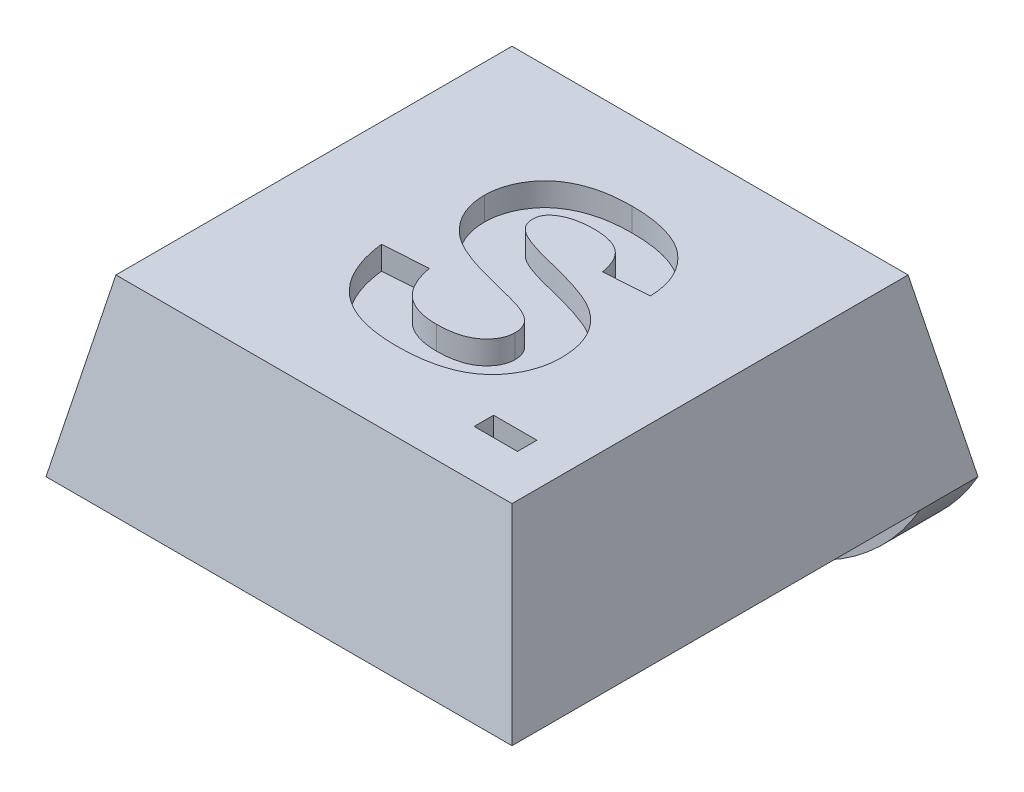
from build123d import *

# Parameters (mm, degrees)
SKETCH1_W               = 8
SKETCH1_H               = 8
BOSS_EXTRUDE1_DEPTH     = 3
CUT_EXTRUDE1_DEPTH      = 12.704699911
CUT_EXTRUDE1_DEPTH_BACK = 12.704699911
CUT_EXTRUDE2_DEPTH      = 11
SKETCH4_R               = 1.75
CUT_EXTRUDE3_DEPTH      = 0.4
SKETCH5_W               = 8
SKETCH5_H               = 1
BOSS_EXTRUDE2_DEPTH     = 2
FILLET1_R               = 4
CUT_EXTRUDE4_DEPTH      = 0.4
SKETCH7_W               = 0.743589743
SKETCH7_H               = 0.333333333
CUT_EXTRUDE5_DEPTH      = 0.5


with BuildPart() as part:
    # Sketch1 → Boss-Extrude1 (new body)
    with BuildSketch(Plane(origin=(0, 0, 0), x_dir=(1, 0, 0), z_dir=(0, 1, 0))):
        with Locations((4, 4)):
            Rectangle(SKETCH1_W, SKETCH1_H)
    extrude(amount=BOSS_EXTRUDE1_DEPTH)

    # Sketch2 → Cut-Extrude1 (cut, two sides: drawn at the far end of the back side and taken through both)
    with BuildSketch(Plane.XY.offset(-CUT_EXTRUDE1_DEPTH_BACK)):
        Polygon((0, 0), (0.6, 3), (0, 3), align=None)
        Polygon((8, 0), (7.4, 3), (8, 3), align=None)
    extrude(amount=CUT_EXTRUDE1_DEPTH + CUT_EXTRUDE1_DEPTH_BACK, mode=Mode.SUBTRACT)

    # Sketch3 → Cut-Extrude2 (cut)
    with BuildSketch(Plane(origin=(0, 0, 0), x_dir=(0, 0, -1), z_dir=(1, 0, 0))):
        Polygon((0, 0), (0.6, 3), (0, 3), align=None)
        Polygon((8, 3), (7.4, 3), (8, 0), align=None)
    extrude(amount=CUT_EXTRUDE2_DEPTH, mode=Mode.SUBTRACT)

    # Sketch4 → Cut-Extrude3 (cut)
    with BuildSketch(Plane.XZ):
        with Locations(Location((4, -3.75, 0), (0, 0, 270))):
            Circle(SKETCH4_R)
    extrude(amount=-CUT_EXTRUDE3_DEPTH, mode=Mode.SUBTRACT)

    # Sketch5 → Boss-Extrude2 (add)
    with BuildSketch(Plane.XZ):
        with Locations((4, -7.5)):
            Rectangle(SKETCH5_W, SKETCH5_H)
    extrude(amount=BOSS_EXTRUDE2_DEPTH)

    # Fillet1
    # the kernel refuses this fillet: 4 mm, written as the material it takes off along each edge
    with BuildSketch(Plane(origin=(8, -2, -16.660254038), x_dir=(0, 1, 0), z_dir=(0, 0, 1)), Plane(origin=(0, -2, 1.660254038), x_dir=(0, 1, 0), z_dir=(0, 0, -1))) as fillet1_piece_1:
        with BuildLine():
            CenterArc((4, 3.464101615), FILLET1_R, 180, 60)
            Line((0, 3.464101615), (-0.08, 3.464101615))
            Line((-0.08, 3.464101615), (-0.08, 0))
            Line((-0.08, 0), (0, -0.08))
            ThreePointArc((0, -0.08), (1, -0.08), (1.96, -0.069282032))
            Line((1.96, -0.069282032), (2, 0))
        make_face()
    extrude(amount=18.320508076, mode=Mode.SUBTRACT)

    # Sketch6 → Cut-Extrude4 (cut)
    with BuildSketch(Plane(origin=(0, 3, 0), x_dir=(1, 0, 0), z_dir=(0, 1, 0))):
        with BuildLine():
            Line((2.423916505, 3.336189685), (3.193147274, 3.387471736))
            add(Edge.make_bspline(
                [(3.193147274, 3.387471736), (3.199275518, 3.35528983), (3.211179242, 3.292778523), (3.237627081, 3.203691377), (3.266738832, 3.12063689), (3.30152897, 3.044505684), (3.339615284, 2.973890515), (3.38412658, 2.910803039), (3.431957638, 2.853229033), (3.485476185, 2.803236311), (3.543783948, 2.759451994), (3.607171876, 2.722111271), (3.674953108, 2.6897922), (3.747293374, 2.663178469), (3.824938253, 2.64331119), (3.907211345, 2.629176798), (3.994230643, 2.620125524), (4.053701404, 2.618879435), (4.084172915, 2.618240967)],
                knots=[0, 0, 0, 0, 1.204560339, 2.339781841, 3.415289417, 4.440034832, 5.416475564, 6.362424008, 7.275913008, 8.16578645, 9.05021719, 9.95355393, 10.867835453, 11.809845306, 12.784702352, 13.812224031, 14.87903166, 16, 16, 16, 16], degree=3))
            add(Edge.make_bspline(
                [(4.084172915, 2.618240967), (4.116246108, 2.618590883), (4.178630121, 2.619271489), (4.269031453, 2.627715), (4.353560804, 2.639811238), (4.431471751, 2.6589593), (4.504219207, 2.680373377), (4.569996427, 2.709670116), (4.629867843, 2.743459668), (4.683679212, 2.781802056), (4.730640445, 2.824326515), (4.771724475, 2.86872067), (4.807505951, 2.914025405), (4.835668504, 2.962251146), (4.858460082, 3.011447443), (4.873523718, 3.063081907), (4.883700097, 3.1159689), (4.884867031, 3.152113555), (4.885454967, 3.1703243)],
                knots=[0, 0, 0, 0, 1.417779877, 2.757654889, 4.012140507, 5.189587551, 6.302846416, 7.360586765, 8.365575446, 9.33904572, 10.275781718, 11.161696098, 12.012180333, 12.822428111, 13.625933072, 14.403138519, 15.195454004, 16, 16, 16, 16], degree=3))
            add(Edge.make_bspline(
                [(4.885454967, 3.1703243), (4.884733913, 3.193140887), (4.883323278, 3.237778199), (4.866340641, 3.301592127), (4.840872442, 3.360713887), (4.802526135, 3.41427025), (4.750979261, 3.463212961), (4.685226085, 3.508997669), (4.603431212, 3.550186), (4.542750055, 3.573160928), (4.510454967, 3.585388403)],
                knots=[0, 0, 0, 0, 0.90494901, 1.770400303, 2.607161909, 3.452839393, 4.36912122, 5.420987164, 6.627424851, 8, 8, 8, 8], degree=3))
            add(Edge.make_bspline(
                [(4.510454967, 3.585388403), (4.496597999, 3.590031937), (4.465588357, 3.600423411), (4.4126892, 3.615282239), (4.348970759, 3.633836968), (4.273512264, 3.654927379), (4.186339087, 3.676497317), (4.088424838, 3.703069034), (3.978575834, 3.729510064), (3.901725338, 3.749028827), (3.861416505, 3.759266608)],
                knots=[0, 0, 0, 0, 0.521821638, 1.167752076, 1.961721917, 2.891982557, 3.96540661, 5.168436773, 6.514817513, 8, 8, 8, 8], degree=3))
            add(Edge.make_bspline(
                [(3.861416505, 3.759266608), (3.808922441, 3.772373151), (3.707643728, 3.797660082), (3.563197092, 3.84264374), (3.430159098, 3.887337495), (3.309810688, 3.935832618), (3.200824367, 3.984842463), (3.104963023, 4.037807847), (3.02022624, 4.091978089), (2.970848149, 4.132466251), (2.947153685, 4.151894813)],
                knots=[0, 0, 0, 0, 1.293880989, 2.496331788, 3.617634808, 4.64976062, 5.598842568, 6.473791081, 7.267636666, 8, 8, 8, 8], degree=3))
            add(Edge.make_bspline(
                [(2.947153685, 4.151894813), (2.917769469, 4.179407128), (2.860158996, 4.233347566), (2.784323751, 4.321982057), (2.720601495, 4.415610216), (2.668151102, 4.513540942), (2.627765291, 4.616338017), (2.599140348, 4.723313361), (2.580613245, 4.834746169), (2.578722682, 4.91063455), (2.577762659, 4.949170454)],
                knots=[0, 0, 0, 0, 1.064429417, 2.086912298, 3.078678339, 4.055528992, 5.020032834, 5.993708893, 6.981211098, 8, 8, 8, 8], degree=3))
            add(Edge.make_bspline(
                [(2.577762659, 4.949170454), (2.579632311, 4.999035454), (2.583341142, 5.097952729), (2.617353538, 5.24334762), (2.670335558, 5.383642492), (2.731782138, 5.495041815), (2.790819043, 5.579315825), (2.839844896, 5.639790083), (2.893704531, 5.696388175), (2.953135712, 5.747729494), (3.015931612, 5.796821395), (3.084525186, 5.840415592), (3.156971597, 5.881478913), (3.261809808, 5.93015757), (3.404151332, 5.980885512), (3.589345301, 6.023645948), (3.790984862, 6.049350493), (3.930782191, 6.052503897), (4.003243428, 6.054138403)],
                knots=[0, 0, 0, 0, 1.180131776, 2.341029169, 3.518901375, 4.725685298, 5.343762192, 5.955650671, 6.568945152, 7.192346361, 7.815201106, 8.455999361, 9.116257477, 9.787318263, 11.192748436, 12.688084276, 14.283332633, 16, 16, 16, 16], degree=3))
            add(Edge.make_bspline(
                [(4.003243428, 6.054138403), (4.062574751, 6.053344994), (4.177972905, 6.051801831), (4.345255933, 6.036197125), (4.501507358, 6.011910245), (4.646178875, 5.977046542), (4.779337891, 5.930982439), (4.901500568, 5.876111383), (5.012563098, 5.81096567), (5.111173405, 5.735171454), (5.199025737, 5.651613191), (5.275662846, 5.560343317), (5.341377732, 5.462514514), (5.396594511, 5.358198276), (5.439956101, 5.246858263), (5.471803478, 5.128633406), (5.492867609, 5.003801978), (5.498147397, 4.918266237), (5.500839582, 4.874651223)],
                knots=[0, 0, 0, 0, 1.325124071, 2.577337985, 3.749592149, 4.855247722, 5.896868755, 6.892903601, 7.842551483, 8.766257401, 9.665194363, 10.546067736, 11.423174165, 12.293291263, 13.177512979, 14.086532529, 15.024315359, 16, 16, 16, 16], degree=3))
            Line((5.500839582, 4.874651223), (4.731608813, 4.823369172))
            add(Edge.make_bspline(
                [(4.731608813, 4.823369172), (4.727171315, 4.847490186), (4.718523093, 4.894499533), (4.699719489, 4.96182647), (4.678509937, 5.024096207), (4.653685255, 5.081308344), (4.623700039, 5.13243816), (4.591067506, 5.179094223), (4.554887475, 5.220654869), (4.51396201, 5.255982033), (4.469697485, 5.288128305), (4.419251527, 5.313894286), (4.364737876, 5.337799444), (4.30408262, 5.355770261), (4.238450559, 5.370025359), (4.167803464, 5.380593162), (4.091994892, 5.385752959), (4.039841388, 5.386885694), (4.012858813, 5.387471736)],
                knots=[0, 0, 0, 0, 1.151066407, 2.24330871, 3.278475654, 4.238599069, 5.165719782, 6.056502506, 6.909492653, 7.744782051, 8.590364415, 9.471203867, 10.39832458, 11.382154319, 12.435022857, 13.550631277, 14.73277401, 16, 16, 16, 16], degree=3))
            add(Edge.make_bspline(
                [(4.012858813, 5.387471736), (3.984804304, 5.386954358), (3.930223002, 5.385947775), (3.850683499, 5.379770524), (3.776069477, 5.368367912), (3.706014485, 5.353524542), (3.640612102, 5.333331162), (3.580000346, 5.308708643), (3.523901913, 5.279720359), (3.489695535, 5.256913378), (3.47279471, 5.245644813)],
                knots=[0, 0, 0, 0, 1.186678824, 2.308736671, 3.37120409, 4.377216403, 5.334874112, 6.262130804, 7.141346615, 8, 8, 8, 8], degree=3))
            add(Edge.make_bspline(
                [(3.47279471, 5.245644813), (3.453453136, 5.230251633), (3.415994509, 5.200439822), (3.3756811, 5.141243702), (3.351412335, 5.074383458), (3.348491314, 5.027102037), (3.346993428, 5.002856352)],
                knots=[0, 0, 0, 0, 1.037857257, 2.010007357, 2.979541333, 4, 4, 4, 4], degree=3))
            add(Edge.make_bspline(
                [(3.346993428, 5.002856352), (3.348218426, 4.980197149), (3.350631475, 4.935562125), (3.374970191, 4.872157107), (3.41239982, 4.813407798), (3.447371668, 4.781494404), (3.465583172, 4.764875582)],
                knots=[0, 0, 0, 0, 0.98538058, 1.941042925, 2.927803204, 4, 4, 4, 4], degree=3))
            add(Edge.make_bspline(
                [(3.465583172, 4.764875582), (3.480036346, 4.754089134), (3.512333176, 4.72998591), (3.571494566, 4.699348433), (3.642903916, 4.666166195), (3.728189187, 4.633726893), (3.826783574, 4.601347807), (3.938693075, 4.567540299), (4.063986517, 4.533278892), (4.199470233, 4.500098399), (4.337024364, 4.467483879), (4.46828848, 4.431827004), (4.590345232, 4.397064309), (4.702628677, 4.360627363), (4.805717615, 4.325156109), (4.899111277, 4.288724577), (4.98345094, 4.253244341), (5.081800337, 4.204456503), (5.193269487, 4.138371404), (5.310101731, 4.042305693), (5.413424942, 3.934321559), (5.485417809, 3.83249997), (5.534873142, 3.744930694), (5.566717158, 3.675127784), (5.59426473, 3.601573118), (5.616688379, 3.524185412), (5.632940128, 3.442855773), (5.646389397, 3.358205559), (5.653260877, 3.269531733), (5.654205671, 3.209062493), (5.654685736, 3.178337121)],
                knots=[0, 0, 0, 0, 0.511875881, 1.143829537, 1.88775736, 2.750598373, 3.734912702, 4.837306479, 6.073130119, 7.42648979, 8.801963576, 10.091065733, 11.292408984, 12.408830014, 13.446061236, 14.39066453, 15.257936293, 16.045629259, 17.510392066, 18.929669597, 20.331293837, 21.746891395, 22.460690638, 23.187651344, 23.925159671, 24.69163991, 25.474819891, 26.281170188, 27.126635539, 28, 28, 28, 28], degree=3))
            add(Edge.make_bspline(
                [(5.654685736, 3.178337121), (5.654025632, 3.150001459), (5.652714728, 3.093729578), (5.643553782, 3.010207902), (5.629386607, 2.928169417), (5.608414322, 2.847511277), (5.580592445, 2.768392154), (5.549267222, 2.689670139), (5.510096795, 2.613061996), (5.465515506, 2.538504273), (5.41634032, 2.466052922), (5.360615699, 2.3992182), (5.301614691, 2.335770341), (5.235567289, 2.279262071), (5.166552067, 2.225117883), (5.091412341, 2.177166881), (5.011908526, 2.133775469), (4.927537931, 2.095267608), (4.838001417, 2.061711489), (4.743415274, 2.031844209), (4.642927337, 2.007400135), (4.537375532, 1.986448484), (4.426373586, 1.970515295), (4.310060277, 1.959390224), (4.188409162, 1.953116354), (4.105547428, 1.952094705), (4.063339582, 1.9515743)],
                knots=[0, 0, 0, 0, 0.900570041, 1.788444861, 2.667795364, 3.545012114, 4.433698372, 5.332345486, 6.235991676, 7.164928091, 8.092777575, 9.015680987, 9.928493428, 10.842962589, 11.775229507, 12.714851019, 13.672254427, 14.652424454, 15.660007982, 16.709910502, 17.803296389, 18.945495772, 20.129342395, 21.366102753, 22.658353839, 24, 24, 24, 24], degree=3))
            add(Edge.make_bspline(
                [(4.063339582, 1.9515743), (4.002397965, 1.952569276), (3.883743193, 1.954506517), (3.711359118, 1.971846347), (3.549674268, 1.998386209), (3.398951853, 2.0369045), (3.259007654, 2.086353292), (3.129905498, 2.147263285), (3.012269836, 2.219998383), (2.90464369, 2.302794639), (2.808461007, 2.397160809), (2.721973345, 2.501141662), (2.646347447, 2.615673526), (2.58163302, 2.740577261), (2.526193974, 2.875177636), (2.480472858, 3.01953646), (2.446047261, 3.174342245), (2.431421007, 3.281307488), (2.423916505, 3.336189685)],
                knots=[0, 0, 0, 0, 1.217954099, 2.371385517, 3.459848295, 4.490682126, 5.476952527, 6.422732854, 7.338496285, 8.236688651, 9.131557988, 10.026443255, 10.935708282, 11.869506048, 12.834296687, 13.842423496, 14.892981177, 16, 16, 16, 16], degree=3))
        make_face()
    extrude(amount=-CUT_EXTRUDE4_DEPTH, mode=Mode.SUBTRACT)

    # Sketch7 → Cut-Extrude5 (cut)
    with BuildSketch(Plane(origin=(0, 3, 0), x_dir=(1, 0, 0), z_dir=(0, 1, 0))):
        with Locations((6.299141853, 1.589907949)):
            Rectangle(SKETCH7_W, SKETCH7_H)
    extrude(amount=-CUT_EXTRUDE5_DEPTH, mode=Mode.SUBTRACT)


solid = part.part
